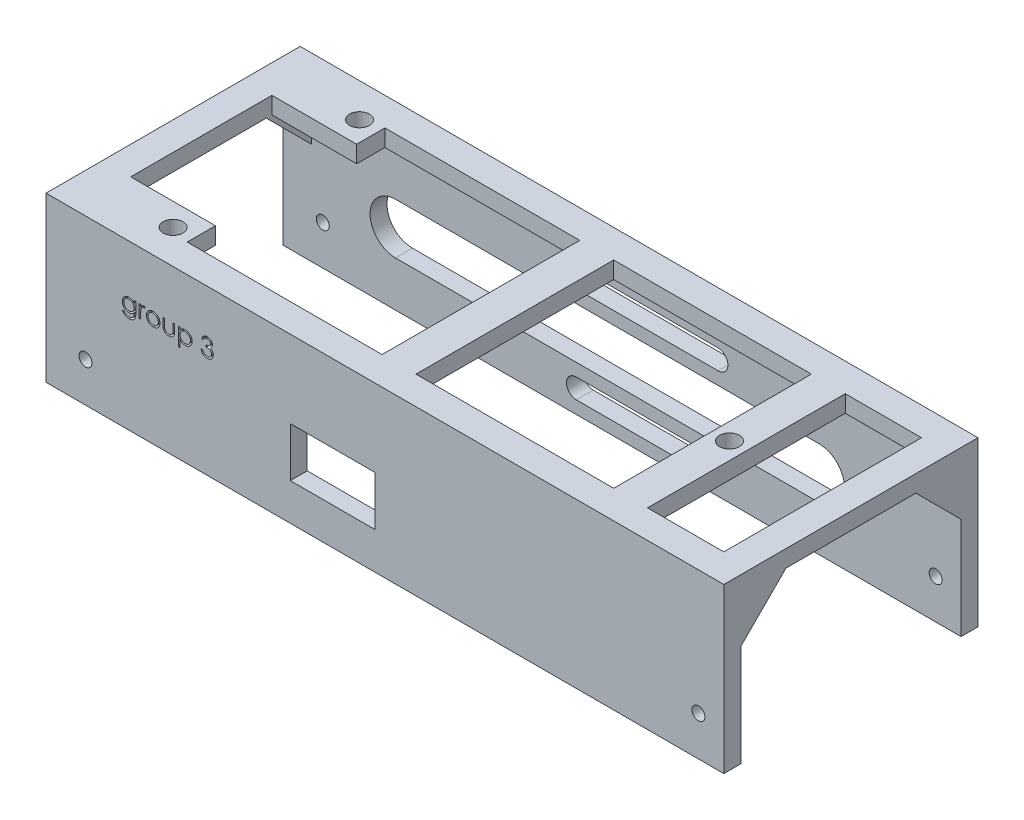
from build123d import *

# Parameters (mm, degrees)
SKETCH1_W           = 120
SKETCH1_H           = 29
BOSS_EXTRUDE5_DEPTH = 45
SHELL9_T            = -3
SKETCH3_R           = 1.15
CUT_EXTRUDE2_DEPTH  = 79
CUT_EXTRUDE8_DEPTH  = 23
SKETCH7_W           = 15
SKETCH7_H           = 8.75
CUT_EXTRUDE9_DEPTH  = 20
SKETCH13_W          = 110
SKETCH13_H          = 35
CUT_EXTRUDE14_DEPTH = 10
SKETCH17_W          = 15
SKETCH17_H          = 5
SKETCH17_W_2        = 6
SKETCH17_H_2        = 35
BOSS_EXTRUDE6_DEPTH = 3
SKETCH17_4_R        = 1.75
CUT_EXTRUDE16_DEPTH = 10
CUT_EXTRUDE15_DEPTH = 1.5
BOSS_EXTRUDE7_DEPTH = 5
BOSS_EXTRUDE8_DEPTH = 5


with BuildPart() as part:
    # Sketch1 → Boss-Extrude5 (new body)
    with BuildSketch(Plane.XY):
        with Locations((60, 14.5)):
            Rectangle(SKETCH1_W, SKETCH1_H)
    extrude(amount=BOSS_EXTRUDE5_DEPTH)

    # Shell9
    shell9_openings = [part.faces().sort_by_distance(p)[0] for p in [
        (120, 14.5, 22.5),
        (60, 0, 22.5),
        (0, 14.5, 22.5),
    ]]
    offset(amount=SHELL9_T, openings=shell9_openings, kind=Kind.INTERSECTION)

    # Sketch3 → Cut-Extrude2 (cut)
    with BuildSketch(Plane(origin=(0, 0, 0), x_dir=(-1, 0, 0), z_dir=(0, 0, -1))):
        with Locations((-7, 7)):
            Circle(SKETCH3_R)
        with Locations((-115.5, 7)):
            Circle(SKETCH3_R)
    extrude(amount=-CUT_EXTRUDE2_DEPTH, mode=Mode.SUBTRACT)

    # Sketch6 → Cut-Extrude8 (cut)
    with BuildSketch(Plane(origin=(0, 0, 0), x_dir=(-1, 0, 0), z_dir=(0, 0, -1))):
        with BuildLine():
            Line((-51.883496676, 22.75), (-76.973496676, 22.75))
            ThreePointArc((-76.973496676, 22.75), (-78.723496676, 21), (-76.973496676, 19.25))
            Line((-76.973496676, 19.25), (-51.883496676, 19.25))
            ThreePointArc((-51.883496676, 19.25), (-50.133496676, 21), (-51.883496676, 22.75))
        make_face()
        with BuildLine():
            Line((-19.873496676, 17), (-94.873496676, 17))
            ThreePointArc((-94.873496676, 17), (-99.373496676, 12.5), (-94.873496676, 8))
            Line((-94.873496676, 8), (-19.873496676, 8))
            ThreePointArc((-19.873496676, 8), (-15.373496676, 12.5), (-19.873496676, 17))
        make_face()
        with BuildLine():
            ThreePointArc((-76.973496676, 5.75), (-78.723496676, 4), (-76.973496676, 2.25))
            Line((-76.973496676, 2.25), (-51.883496676, 2.25))
            ThreePointArc((-51.883496676, 2.25), (-50.133496676, 4), (-51.883496676, 5.75))
            Line((-51.883496676, 5.75), (-76.973496676, 5.75))
        make_face()
    extrude(amount=-CUT_EXTRUDE8_DEPTH, mode=Mode.SUBTRACT)

    # Sketch7 → Cut-Extrude9 (cut)
    with BuildSketch(Plane.XY.offset(45)):
        with Locations((50.746172795, 10.921245049)):
            Rectangle(SKETCH7_W, SKETCH7_H)
    extrude(amount=-CUT_EXTRUDE9_DEPTH, mode=Mode.SUBTRACT)

    # Sketch13 → Cut-Extrude14 (cut)
    with BuildSketch(Plane(origin=(0, 29, 0), x_dir=(1, 0, 0), z_dir=(0, 1, 0))):
        with Locations((60, -22.5)):
            Rectangle(SKETCH13_W, SKETCH13_H)
    extrude(amount=-CUT_EXTRUDE14_DEPTH, mode=Mode.SUBTRACT)

    # Sketch17 → Boss-Extrude6 (add)
    with BuildSketch(Plane(origin=(0, 29, 0), x_dir=(1, 0, 0), z_dir=(0, 1, 0))):
        with Locations((12.5, -7.5)):
            Rectangle(SKETCH17_W, SKETCH17_H)
        with Locations((12.5, -37.5)):
            Rectangle(SKETCH17_W, SKETCH17_H)
        with Locations((57.5, -22.5)):
            Rectangle(SKETCH17_W_2, SKETCH17_H_2)
        with Locations((98.5, -22.5)):
            Rectangle(SKETCH17_W_2, SKETCH17_H_2)
    extrude(amount=-BOSS_EXTRUDE6_DEPTH)

    # Sketch17<4> → Cut-Extrude16 (cut)
    with BuildSketch(Plane(origin=(0, 29, 0), x_dir=(1, 0, 0), z_dir=(0, 1, 0))):
        with Locations((98.5, -22.5)):
            Circle(SKETCH17_4_R)
        with Locations((16.5, -6)):
            Circle(SKETCH17_4_R)
        with Locations((16.5, -39)):
            Circle(SKETCH17_4_R)
    extrude(amount=-CUT_EXTRUDE16_DEPTH, mode=Mode.SUBTRACT)

    # Sketch20 → Cut-Extrude15 (cut)
    # profile 1 of 6: a face of its own
    with BuildSketch(Plane.XY.offset(45)):
        with BuildLine():
            Line((15.616704574, 20.332761713), (15.901640472, 20.332761713))
            Line((15.901640472, 20.332761713), (15.901640472, 18.49149068))
            add(Edge.make_bspline(
                [(15.901640472, 18.49149068), (15.901389155, 18.452268005), (15.900904052, 18.376558794), (15.897410671, 18.267086354), (15.890044057, 18.165970691), (15.881690467, 18.072750642), (15.869673803, 17.9878583), (15.854999527, 17.91104035), (15.838457161, 17.842223075), (15.823924535, 17.799836969), (15.817050127, 17.779786954)],
                knots=[0, 0, 0, 0, 1.307562039, 2.523909702, 3.650326591, 4.686913197, 5.643429486, 6.506965704, 7.293745905, 8, 8, 8, 8], degree=3))
            add(Edge.make_bspline(
                [(15.817050127, 17.779786954), (15.806899889, 17.753724811), (15.786902899, 17.702379766), (15.749450931, 17.629595775), (15.707510176, 17.561064407), (15.659606909, 17.497167576), (15.605957751, 17.438226048), (15.547826683, 17.382959277), (15.484081581, 17.332536497), (15.414758892, 17.287827692), (15.341456639, 17.247562292), (15.264216961, 17.212685764), (15.183475406, 17.182308413), (15.098473497, 17.159554734), (15.010543928, 17.139838237), (14.918652687, 17.127006986), (14.823336649, 17.118273869), (14.758525483, 17.117466301), (14.725643877, 17.117056585)],
                knots=[0, 0, 0, 0, 0.981931301, 1.934503488, 2.87077864, 3.801706999, 4.735015492, 5.667491629, 6.616593066, 7.585388521, 8.561939025, 9.551802639, 10.560317337, 11.588439944, 12.640189604, 13.723962949, 14.845264515, 16, 16, 16, 16], degree=3))
            add(Edge.make_bspline(
                [(14.725643877, 17.117056585), (14.677669868, 17.11783354), (14.583963739, 17.119351142), (14.447343495, 17.137032186), (14.317590571, 17.162027939), (14.196419457, 17.19986072), (14.084595869, 17.246158561), (13.982883496, 17.299312554), (13.89219542, 17.360262855), (13.810440374, 17.429659829), (13.736651931, 17.512176883), (13.667230747, 17.609421549), (13.600409749, 17.722875084), (13.561249628, 17.806144188), (13.540743036, 17.849748893)],
                knots=[0, 0, 0, 0, 1.157897085, 2.2616841, 3.32207898, 4.345638746, 5.321241055, 6.241986252, 7.112515963, 7.955008012, 8.825025602, 9.77857164, 10.836726669, 12, 12, 12, 12], degree=3))
            Line((13.540743036, 17.849748893), (13.825678933, 17.849748893))
            add(Edge.make_bspline(
                [(13.825678933, 17.849748893), (13.848595366, 17.813367134), (13.89339417, 17.742245276), (13.977167435, 17.650158342), (14.068976031, 17.571460647), (14.171918315, 17.508041587), (14.286422618, 17.460226276), (14.412557826, 17.426140115), (14.55135034, 17.405732787), (14.647977577, 17.403273256), (14.698295119, 17.401992483)],
                knots=[0, 0, 0, 0, 0.997731894, 1.950442991, 2.880492273, 3.800895997, 4.748200782, 5.754801363, 6.83083817, 8, 8, 8, 8], degree=3))
            add(Edge.make_bspline(
                [(14.698295119, 17.401992483), (14.747976513, 17.403289832), (14.843757266, 17.405790991), (14.981489827, 17.426149222), (15.107215235, 17.460233694), (15.220209131, 17.507957016), (15.319138293, 17.566422742), (15.404420599, 17.631737095), (15.473494698, 17.705379862), (15.519952175, 17.773217644), (15.548830721, 17.833655247), (15.567220536, 17.885682245), (15.582164779, 17.944513069), (15.594665061, 18.009950487), (15.604980103, 18.08208799), (15.611514147, 18.161090521), (15.616236561, 18.246778529), (15.616544963, 18.306190162), (15.616704574, 18.336938396)],
                knots=[0, 0, 0, 0, 1.570740765, 3.028230971, 4.391408896, 5.680370741, 6.894727393, 8.017376726, 9.065722033, 10.075533815, 10.603371122, 11.180248986, 11.817768598, 12.521299649, 13.286540596, 14.121245857, 15.027658897, 16, 16, 16, 16], degree=3))
            Line((15.616704574, 18.336938396), (15.616704574, 18.457145728))
            add(Edge.make_bspline(
                [(15.616704574, 18.457145728), (15.587783846, 18.422727093), (15.530451097, 18.354495237), (15.431438879, 18.265085752), (15.323292106, 18.188081905), (15.206194892, 18.124927858), (15.083015558, 18.074416852), (14.955088249, 18.039090023), (14.823559742, 18.016266399), (14.734431006, 18.013810477), (14.689390872, 18.012569406)],
                knots=[0, 0, 0, 0, 1.012485704, 2.007162095, 2.997754123, 3.998611389, 4.999708251, 5.992315798, 6.98544096, 8, 8, 8, 8], degree=3))
            add(Edge.make_bspline(
                [(14.689390872, 18.012569406), (14.662869399, 18.013036608), (14.610140308, 18.013965485), (14.531804216, 18.022092376), (14.454624104, 18.033884092), (14.378779973, 18.051193683), (14.304162381, 18.073411178), (14.230894637, 18.101184934), (14.158383509, 18.132585791), (14.087947043, 18.169572548), (14.020286767, 18.210722641), (13.955913021, 18.255298635), (13.895162989, 18.303067225), (13.838614888, 18.354499449), (13.786342893, 18.409520868), (13.737643956, 18.467544948), (13.693323362, 18.52938192), (13.652471645, 18.593904232), (13.617040867, 18.661541641), (13.585940044, 18.730827485), (13.558898655, 18.801613615), (13.537340041, 18.874137022), (13.520874388, 18.948351984), (13.508618682, 19.02413692), (13.501667308, 19.1017252), (13.500583341, 19.153995995), (13.500037908, 19.180297771)],
                knots=[0, 0, 0, 0, 1.028754217, 2.045334182, 3.052854819, 4.056607503, 5.061168794, 6.071104265, 7.095078842, 8.125279047, 9.155117945, 10.165957491, 11.161587969, 12.151493252, 13.128948131, 14.104219989, 15.088194871, 16.07871515, 17.064853787, 18.047899887, 19.02414258, 20.002704429, 20.980574569, 21.971845993, 22.979467364, 24, 24, 24, 24], degree=3))
            add(Edge.make_bspline(
                [(13.500037908, 19.180297771), (13.500508866, 19.206607723), (13.501448958, 19.259125723), (13.509568775, 19.337030594), (13.521151346, 19.413892296), (13.53948268, 19.488918582), (13.561546682, 19.562963892), (13.588873066, 19.635481306), (13.621728655, 19.706492911), (13.658930356, 19.776051293), (13.700735212, 19.843223058), (13.746575391, 19.907019373), (13.796506234, 19.966970786), (13.8498389, 20.023682111), (13.907224591, 20.07660618), (13.96863362, 20.125614541), (14.033460661, 20.171528693), (14.101906631, 20.213358264), (14.172915405, 20.250353587), (14.24468294, 20.284110729), (14.31815991, 20.310902394), (14.391976428, 20.334509063), (14.467432493, 20.351232418), (14.543602915, 20.364134024), (14.620748464, 20.371994163), (14.672412876, 20.372975315), (14.698295119, 20.373466842)],
                knots=[0, 0, 0, 0, 1.008818848, 2.013730394, 3.001654427, 3.987803273, 4.973046549, 5.963777569, 6.957074694, 7.972068341, 8.987420212, 9.989399531, 10.982630087, 11.977756091, 12.973280677, 13.973972381, 14.989194003, 16.018387222, 17.047741039, 18.059210846, 19.057554164, 20.045176975, 21.029480261, 22.018708529, 23.007435371, 24, 24, 24, 24], degree=3))
            add(Edge.make_bspline(
                [(14.698295119, 20.373466842), (14.740977042, 20.372236145), (14.825260726, 20.369805898), (14.949295278, 20.350736716), (15.068985739, 20.320334718), (15.18500751, 20.276777682), (15.298305708, 20.217314433), (15.408506924, 20.138989044), (15.515929996, 20.04109895), (15.582222028, 19.966030281), (15.616704574, 19.926982467)],
                knots=[0, 0, 0, 0, 0.96728863, 1.910097829, 2.838038873, 3.762875196, 4.71315279, 5.730631239, 6.819562287, 8, 8, 8, 8], degree=3))
            Line((15.616704574, 19.926982467), (15.616704574, 20.332761713))
        make_face()
        with BuildLine():
            add(Edge.make_bspline(
                [(14.721191754, 20.088530944), (14.679526044, 20.087114835), (14.597036773, 20.084311238), (14.476125205, 20.060376534), (14.359396844, 20.022869897), (14.249083349, 19.969219095), (14.145753328, 19.903819322), (14.054064026, 19.824589204), (13.973868138, 19.734105154), (13.90602933, 19.633185287), (13.852025876, 19.524307938), (13.813795774, 19.409544629), (13.78907611, 19.290749742), (13.78634774, 19.209676024), (13.784973805, 19.168849454)],
                knots=[0, 0, 0, 0, 1.026226791, 2.031711442, 3.026614839, 4.04107745, 5.047145931, 6.032893242, 7.017642609, 8.019221815, 9.021877557, 10.003543541, 10.994637589, 12, 12, 12, 12], degree=3))
            add(Edge.make_bspline(
                [(13.784973805, 19.168849454), (13.78563217, 19.138067128), (13.786926982, 19.077527295), (13.799376227, 18.988683633), (13.819497532, 18.904065063), (13.848015569, 18.823666466), (13.883351228, 18.747026688), (13.927794307, 18.674673668), (13.980091974, 18.60654297), (14.039834895, 18.543138509), (14.105672041, 18.485388916), (14.177081601, 18.434645122), (14.25396672, 18.393142682), (14.334436469, 18.357273494), (14.42044337, 18.331076054), (14.510748612, 18.311083733), (14.605991079, 18.299645788), (14.670916871, 18.298228108), (14.704019278, 18.297505303)],
                knots=[0, 0, 0, 0, 1.039728707, 2.044842319, 3.024901384, 3.974314358, 4.923051295, 5.871625912, 6.837440708, 7.820715446, 8.810779094, 9.792721783, 10.773906224, 11.758876063, 12.764959493, 13.806266761, 14.881525401, 16, 16, 16, 16], degree=3))
            add(Edge.make_bspline(
                [(14.704019278, 18.297505303), (14.737550687, 18.298201634), (14.803121003, 18.299563302), (14.898888923, 18.311268619), (14.989632909, 18.330157126), (15.075269755, 18.356975013), (15.1561228, 18.39119403), (15.231283772, 18.434497961), (15.302364264, 18.483814268), (15.367094722, 18.541338023), (15.425627358, 18.604733697), (15.476636696, 18.673717281), (15.520101946, 18.747250752), (15.556095261, 18.825325821), (15.583573711, 18.908549241), (15.60200586, 18.996712964), (15.614893407, 19.089394606), (15.616091675, 19.152902422), (15.616704574, 19.185385912)],
                knots=[0, 0, 0, 0, 1.121943988, 2.193949579, 3.223793937, 4.220241907, 5.192961521, 6.155822191, 7.11847367, 8.083710714, 9.04790392, 10.001595906, 10.949595423, 11.902125208, 12.873731292, 13.87582262, 14.913508608, 16, 16, 16, 16], degree=3))
            add(Edge.make_bspline(
                [(15.616704574, 19.185385912), (15.615489395, 19.227674965), (15.613115361, 19.310292915), (15.59071151, 19.430676912), (15.554588891, 19.543859923), (15.503927909, 19.649483987), (15.440444229, 19.746429935), (15.363980388, 19.83290228), (15.27585506, 19.909012343), (15.176321441, 19.97241999), (15.069235544, 20.023642205), (14.957184173, 20.062070384), (14.840333683, 20.083836656), (14.761134297, 20.086957176), (14.721191754, 20.088530944)],
                knots=[0, 0, 0, 0, 1.070913519, 2.092188694, 3.091357305, 4.074328408, 5.051968682, 6.018948707, 6.99050112, 7.9935919, 9.000589572, 9.992915277, 10.987769056, 12, 12, 12, 12], degree=3))
        make_face(mode=Mode.SUBTRACT)
    # profile 2 of 6: a face of its own
    with BuildSketch(Plane.XY.offset(45)):
        with BuildLine():
            Line((16.471512267, 20.332761713), (16.756448164, 20.332761713))
            Line((16.756448164, 20.332761713), (16.756448164, 19.991220247))
            add(Edge.make_bspline(
                [(16.756448164, 19.991220247), (16.777483681, 20.023020891), (16.817713944, 20.083839376), (16.884582101, 20.1642751), (16.953074409, 20.230873035), (17.023518757, 20.283944084), (17.096433176, 20.323688842), (17.170217411, 20.352801809), (17.246032302, 20.370016945), (17.29697919, 20.372315336), (17.322503853, 20.373466842)],
                knots=[0, 0, 0, 0, 1.2804753, 2.448899062, 3.506932113, 4.484331642, 5.4025378, 6.288909075, 7.142734305, 8, 8, 8, 8], degree=3))
            add(Edge.make_bspline(
                [(17.322503853, 20.373466842), (17.342303449, 20.372386864), (17.383042405, 20.37016474), (17.444712326, 20.354552063), (17.508251743, 20.329625571), (17.549202337, 20.306184798), (17.570550728, 20.293964638)],
                knots=[0, 0, 0, 0, 0.901110191, 1.854092781, 2.881294221, 4, 4, 4, 4], degree=3))
            Line((17.570550728, 20.293964638), (17.414090392, 20.047189798))
            add(Edge.make_bspline(
                [(17.414090392, 20.047189798), (17.400384351, 20.053304183), (17.374367662, 20.064910455), (17.336308877, 20.078646421), (17.301219379, 20.08673443), (17.278864151, 20.087959724), (17.268442355, 20.088530944)],
                knots=[0, 0, 0, 0, 1.180555205, 2.24091978, 3.179933427, 4, 4, 4, 4], degree=3))
            add(Edge.make_bspline(
                [(17.268442355, 20.088530944), (17.245577154, 20.08700691), (17.198938771, 20.083898323), (17.130463547, 20.059460976), (17.064017868, 20.019977365), (17.01124786, 19.976188571), (16.970388102, 19.933963069), (16.941232326, 19.897089161), (16.914487262, 19.855742831), (16.888932848, 19.810630903), (16.865649853, 19.760983115), (16.843919546, 19.707295485), (16.824271863, 19.649505833), (16.813068427, 19.609244546), (16.807329574, 19.588621088)],
                knots=[0, 0, 0, 0, 1.125678352, 2.296057538, 3.5422874, 4.923748041, 5.663163013, 6.437101912, 7.23742474, 8.08941207, 8.991984279, 9.93940061, 10.944477711, 12, 12, 12, 12], degree=3))
            add(Edge.make_bspline(
                [(16.807329574, 19.588621088), (16.803036618, 19.570226795), (16.793528044, 19.529484834), (16.784282864, 19.461132958), (16.775148372, 19.380375782), (16.768710726, 19.286988515), (16.762743502, 19.18120437), (16.759377927, 19.06286219), (16.756562935, 18.931840507), (16.756487582, 18.840242344), (16.756448164, 18.792327018)],
                knots=[0, 0, 0, 0, 0.566838948, 1.255505196, 2.06880316, 3.007127437, 4.065329342, 5.249902469, 6.561414163, 8, 8, 8, 8], degree=3))
            Line((16.756448164, 18.792327018), (16.756448164, 18.012569406))
            Line((16.756448164, 18.012569406), (16.471512267, 18.012569406))
            Line((16.471512267, 18.012569406), (16.471512267, 20.332761713))
        make_face()
    # profile 3 of 6: a face of its own
    with BuildSketch(Plane.XY.offset(45)):
        with BuildLine():
            add(Edge.make_bspline(
                [(18.976149687, 20.373466842), (19.019684627, 20.37253984), (19.105046006, 20.370722218), (19.230057445, 20.351295784), (19.349387675, 20.321589247), (19.463493721, 20.280521473), (19.570914218, 20.225474275), (19.673213846, 20.159788703), (19.770112133, 20.081971636), (19.828190167, 20.021775389), (19.857670119, 19.991220247)],
                knots=[0, 0, 0, 0, 1.054011418, 2.066658804, 3.057071809, 4.030435133, 4.997543892, 5.974964718, 6.972108034, 8, 8, 8, 8], degree=3))
            add(Edge.make_bspline(
                [(19.857670119, 19.991220247), (19.883053749, 19.96199756), (19.933329765, 19.904117725), (19.997796525, 19.810268705), (20.053333226, 19.713077328), (20.09784034, 19.611252967), (20.132933183, 19.505684516), (20.157848493, 19.39600912), (20.172668427, 19.282468991), (20.174666833, 19.205358366), (20.175678933, 19.166305383)],
                knots=[0, 0, 0, 0, 1.025258237, 2.030674902, 3.01204498, 3.988269485, 4.97094183, 5.956517959, 6.965070386, 8, 8, 8, 8], degree=3))
            add(Edge.make_bspline(
                [(20.175678933, 19.166305383), (20.17478872, 19.127026045), (20.173029618, 19.049408242), (20.156389337, 18.935090674), (20.130507566, 18.824242513), (20.093467256, 18.717327841), (20.045970971, 18.614019848), (19.98801299, 18.514769757), (19.919186595, 18.41938175), (19.841168683, 18.328665797), (19.754943053, 18.245057873), (19.661401975, 18.172188657), (19.562383673, 18.109757703), (19.456571489, 18.059468955), (19.344931697, 18.019818012), (19.227223499, 17.991968712), (19.103629757, 17.975130613), (19.019240778, 17.972968371), (18.976149687, 17.971864278)],
                knots=[0, 0, 0, 0, 0.998656419, 1.973391657, 2.932242238, 3.890759089, 4.846373663, 5.82037756, 6.809684879, 7.83454468, 8.860553229, 9.859544525, 10.845671541, 11.83227036, 12.833544569, 13.85385346, 14.904124723, 16, 16, 16, 16], degree=3))
            add(Edge.make_bspline(
                [(18.976149687, 17.971864278), (18.932847477, 17.972972077), (18.848037911, 17.975141758), (18.724007913, 17.991903293), (18.606088759, 18.019805177), (18.494302816, 18.05959926), (18.388035705, 18.10975931), (18.288443668, 18.171999915), (18.194826602, 18.245079484), (18.10858273, 18.328659941), (18.03056971, 18.419383259), (17.961742052, 18.514769365), (17.903784399, 18.61401995), (17.856288029, 18.717327814), (17.819247741, 18.824242521), (17.793365964, 18.935090672), (17.776725685, 19.049408242), (17.774966583, 19.127026045), (17.774076369, 19.166305383)],
                knots=[0, 0, 0, 0, 1.099876186, 2.154163076, 3.173186993, 4.173200201, 5.163417411, 6.152872554, 7.150605724, 8.17532212, 9.198891216, 10.186952605, 11.159729845, 12.11414092, 13.071450619, 14.029093627, 15.002601286, 16, 16, 16, 16], degree=3))
            add(Edge.make_bspline(
                [(17.774076369, 19.166305383), (17.775095372, 19.205146107), (17.777112823, 19.282044065), (17.791917856, 19.395370756), (17.816735975, 19.50486053), (17.851870885, 19.610021498), (17.896788237, 19.711399643), (17.951544548, 19.808831168), (18.016668907, 19.902255816), (18.066744963, 19.960060846), (18.092085183, 19.989312194)],
                knots=[0, 0, 0, 0, 1.031353054, 2.041901799, 3.029428768, 4.008703097, 4.981709435, 5.96992636, 6.972712378, 8, 8, 8, 8], degree=3))
            add(Edge.make_bspline(
                [(18.092085183, 19.989312194), (18.121520691, 20.020132318), (18.179410796, 20.080745514), (18.276791428, 20.158335732), (18.378839394, 20.22538817), (18.487447005, 20.279341594), (18.601459312, 20.321830821), (18.721401054, 20.351372396), (18.8468367, 20.370652225), (18.932615785, 20.372519286), (18.976149687, 20.373466842)],
                knots=[0, 0, 0, 0, 1.027980169, 2.021703884, 2.998553061, 3.971491411, 4.943284454, 5.930300938, 6.949603206, 8, 8, 8, 8], degree=3))
        make_face()
        with BuildLine():
            add(Edge.make_bspline(
                [(18.974877651, 20.088530944), (18.94409139, 20.087655922), (18.883313609, 20.085928465), (18.793851557, 20.072789495), (18.707727274, 20.05197283), (18.624777366, 20.022396294), (18.545281559, 19.984206578), (18.469163744, 19.937299709), (18.396200031, 19.882296955), (18.327817731, 19.819284389), (18.26505949, 19.750451301), (18.210197326, 19.67711029), (18.163547408, 19.600450961), (18.124685264, 19.520393598), (18.095740886, 19.436126908), (18.074719644, 19.348605193), (18.061593069, 19.257650137), (18.059881854, 19.195818356), (18.059012267, 19.16439733)],
                knots=[0, 0, 0, 0, 1.021534396, 2.016698045, 2.994645724, 3.958388632, 4.93408049, 5.916473867, 6.921342795, 7.962252576, 8.998418191, 10.008913653, 10.997312074, 11.973003931, 12.956656626, 13.948281152, 14.957379055, 16, 16, 16, 16], degree=3))
            add(Edge.make_bspline(
                [(18.059012267, 19.16439733), (18.060469885, 19.123800849), (18.063362986, 19.043224424), (18.08688995, 18.924560048), (18.126247504, 18.810639368), (18.179394536, 18.702130218), (18.245984463, 18.601734651), (18.324440588, 18.512225519), (18.413920888, 18.434949819), (18.513358713, 18.370832194), (18.620722987, 18.319887273), (18.734348364, 18.283783917), (18.852858136, 18.260314596), (18.933848514, 18.257981901), (18.974877651, 18.256800175)],
                knots=[0, 0, 0, 0, 1.016792936, 2.018143844, 3.017858371, 4.030088057, 5.03801393, 6.028138512, 7.003788237, 7.991172063, 8.984598303, 9.972568034, 10.972917682, 12, 12, 12, 12], degree=3))
            add(Edge.make_bspline(
                [(18.974877651, 18.256800175), (19.015904429, 18.257988786), (19.096890148, 18.260335072), (19.215235258, 18.283665716), (19.328550076, 18.320045465), (19.435802834, 18.370774898), (19.535195396, 18.435193303), (19.625319242, 18.51178916), (19.703105482, 18.601971725), (19.769629538, 18.702263197), (19.82364694, 18.810471145), (19.862820273, 18.924581074), (19.886403798, 19.043219069), (19.889289264, 19.123799055), (19.890743036, 19.16439733)],
                knots=[0, 0, 0, 0, 1.02726834, 2.027799167, 3.010890988, 4.004497153, 4.992059811, 5.971914811, 6.958719428, 7.966827853, 8.981595046, 9.981490638, 10.983022906, 12, 12, 12, 12], degree=3))
            add(Edge.make_bspline(
                [(19.890743036, 19.16439733), (19.889873748, 19.195818544), (19.888163122, 19.257650694), (19.875032262, 19.348603063), (19.854026879, 19.436134725), (19.825024055, 19.520364757), (19.786330771, 19.600658243), (19.738781252, 19.67688521), (19.684143107, 19.750705362), (19.620627576, 19.819061879), (19.552316655, 19.882321519), (19.47932337, 19.937321037), (19.403318425, 19.984000427), (19.324053568, 20.022722945), (19.241093025, 20.051703747), (19.155089415, 20.072909691), (19.066009066, 20.085872941), (19.005449077, 20.087639276), (18.974877651, 20.088530944)],
                knots=[0, 0, 0, 0, 1.042956736, 2.052379634, 3.044323526, 4.02829302, 5.004299113, 5.996692471, 7.007513377, 8.048758398, 9.090003419, 10.095195979, 11.07790575, 12.047570684, 13.018257071, 13.989683339, 14.985167495, 16, 16, 16, 16], degree=3))
        make_face(mode=Mode.SUBTRACT)
    # profile 4 of 6: a face of its own
    with BuildSketch(Plane.XY.offset(45)):
        with BuildLine():
            Line((20.7048456, 20.332761713), (20.989781497, 20.332761713))
            Line((20.989781497, 20.332761713), (20.989781497, 19.256619887))
            add(Edge.make_bspline(
                [(20.989781497, 19.256619887), (20.989910225, 19.225030678), (20.990156476, 19.164602003), (20.991826473, 19.077647655), (20.995754486, 18.998348208), (21.000665598, 18.926657854), (21.00698125, 18.86258872), (21.014495442, 18.806364589), (21.022894153, 18.757347865), (21.031115329, 18.727826393), (21.034938749, 18.71409685)],
                knots=[0, 0, 0, 0, 1.388932606, 2.656963016, 3.823490214, 4.879454478, 5.816252168, 6.653371382, 7.373723809, 8, 8, 8, 8], degree=3))
            add(Edge.make_bspline(
                [(21.034938749, 18.71409685), (21.041072355, 18.696840388), (21.05321205, 18.662686223), (21.075231567, 18.613347625), (21.102471558, 18.567650048), (21.132280116, 18.523831353), (21.166660293, 18.483189551), (21.205177099, 18.445793272), (21.246541214, 18.410229561), (21.3080047, 18.368151928), (21.392059891, 18.323053022), (21.502416319, 18.284140387), (21.622072295, 18.260885035), (21.704771719, 18.258186961), (21.747278493, 18.256800175)],
                knots=[0, 0, 0, 0, 0.725840625, 1.436591201, 2.137033971, 2.831655856, 3.53531722, 4.242432219, 4.957935707, 5.694543706, 7.190802206, 8.724350549, 10.316345118, 12, 12, 12, 12], degree=3))
            add(Edge.make_bspline(
                [(21.747278493, 18.256800175), (21.789781318, 18.258216451), (21.872016419, 18.260956682), (21.990357713, 18.283438892), (22.098535782, 18.320999767), (22.195464859, 18.373439347), (22.2807053, 18.437612504), (22.351738594, 18.512913352), (22.410346603, 18.596959582), (22.435936578, 18.659665178), (22.448805937, 18.691200215)],
                knots=[0, 0, 0, 0, 1.157059328, 2.238695713, 3.266970494, 4.264342957, 5.228770407, 6.160125903, 7.074715775, 8, 8, 8, 8], degree=3))
            add(Edge.make_bspline(
                [(22.448805937, 18.691200215), (22.452610702, 18.703869643), (22.46102211, 18.731878654), (22.470059386, 18.779394569), (22.478200505, 18.836058889), (22.485152101, 18.902242407), (22.490109784, 18.977772166), (22.492782251, 19.062624564), (22.495801472, 19.156533227), (22.495847297, 19.222271837), (22.495871241, 19.256619887)],
                knots=[0, 0, 0, 0, 0.557542046, 1.232589297, 2.036731608, 2.971723315, 4.038036528, 5.22795436, 6.551621927, 8, 8, 8, 8], degree=3))
            Line((22.495871241, 19.256619887), (22.495871241, 20.332761713))
            Line((22.495871241, 20.332761713), (22.780807138, 20.332761713))
            Line((22.780807138, 20.332761713), (22.780807138, 19.203194406))
            add(Edge.make_bspline(
                [(22.780807138, 19.203194406), (22.780406458, 19.164815757), (22.779629084, 19.09035593), (22.774633136, 18.9821482), (22.766060988, 18.881308163), (22.753050123, 18.787782443), (22.737750547, 18.701642441), (22.7180145, 18.622777758), (22.694448527, 18.551431377), (22.667864238, 18.486351337), (22.636457258, 18.427344511), (22.60304989, 18.371341306), (22.564473847, 18.319731286), (22.523860848, 18.269945348), (22.478683632, 18.224459819), (22.42978876, 18.18223098), (22.377864429, 18.142613302), (22.321758371, 18.107151927), (22.262289657, 18.075205398), (22.199384872, 18.046887956), (22.132273538, 18.02447919), (22.061821525, 18.005147372), (21.98768366, 17.98998496), (21.909931418, 17.97929286), (21.828590988, 17.972738453), (21.773155978, 17.972160562), (21.744734422, 17.971864278)],
                knots=[0, 0, 0, 0, 1.493040784, 2.896703357, 4.213163133, 5.428574705, 6.569057535, 7.615249723, 8.588095153, 9.490268104, 10.346124644, 11.18633936, 12.024365274, 12.850166724, 13.684164916, 14.514361689, 15.362232829, 16.222528818, 17.093394965, 17.986930858, 18.902426812, 19.842810585, 20.827885679, 21.843828298, 22.894529745, 24, 24, 24, 24], degree=3))
            add(Edge.make_bspline(
                [(21.744734422, 17.971864278), (21.716525441, 17.97217244), (21.661092168, 17.972778009), (21.57974754, 17.979256649), (21.501779875, 17.989968347), (21.427466371, 18.005258437), (21.356732454, 18.024343879), (21.289291607, 18.047025657), (21.225933518, 18.075220094), (21.165896986, 18.106949736), (21.109651962, 18.142841093), (21.056939181, 18.1821821), (21.007829322, 18.224914029), (20.962311553, 18.270858417), (20.921024781, 18.320585209), (20.883454515, 18.373694396), (20.849022361, 18.429659748), (20.817859472, 18.489588474), (20.791088094, 18.555421654), (20.767452264, 18.628262592), (20.748120471, 18.708909875), (20.732388374, 18.797294553), (20.719732425, 18.892993627), (20.71094571, 18.996560689), (20.706032778, 19.107743467), (20.705249858, 19.18453301), (20.7048456, 19.224182988)],
                knots=[0, 0, 0, 0, 1.083640291, 2.129454052, 3.13281866, 4.105697902, 5.042300162, 5.946461698, 6.836384745, 7.703652036, 8.553297018, 9.397182691, 10.228592656, 11.052265423, 11.879314572, 12.708807002, 13.549817954, 14.402308542, 15.300838682, 16.27712199, 17.341985831, 18.484375296, 19.725102775, 21.0496083, 22.476576903, 24, 24, 24, 24], degree=3))
            Line((20.7048456, 19.224182988), (20.7048456, 20.332761713))
        make_face()
    # profile 5 of 6: a face of its own
    with BuildSketch(Plane.XY.offset(45)):
        with BuildLine():
            Line((23.43208919, 20.332761713), (23.717025087, 20.332761713))
            Line((23.717025087, 20.332761713), (23.717025087, 19.903449814))
            add(Edge.make_bspline(
                [(23.717025087, 19.903449814), (23.747285091, 19.942400473), (23.806089351, 20.018093283), (23.907439801, 20.116055757), (24.014416263, 20.198674068), (24.129771645, 20.263428223), (24.251713135, 20.312251388), (24.379740309, 20.348337032), (24.51493976, 20.369601798), (24.607374399, 20.372161448), (24.654515071, 20.373466842)],
                knots=[0, 0, 0, 0, 1.0828784, 2.104357462, 3.088488658, 4.04616522, 5.001424249, 5.969181776, 6.964304535, 8, 8, 8, 8], degree=3))
            add(Edge.make_bspline(
                [(24.654515071, 20.373466842), (24.69569174, 20.372275601), (24.777079588, 20.369921051), (24.896879803, 20.35397978), (25.012246044, 20.32665873), (25.122525636, 20.2872879), (25.228899988, 20.238614724), (25.329794321, 20.177185698), (25.42678019, 20.106060082), (25.517418447, 20.024206631), (25.601167116, 19.935643847), (25.673599009, 19.840373614), (25.736075665, 19.741528982), (25.786576577, 19.637577584), (25.826135578, 19.529337997), (25.854270321, 19.416372911), (25.87101404, 19.299101165), (25.873260536, 19.21936084), (25.874396882, 19.179025736)],
                knots=[0, 0, 0, 0, 1.041296284, 2.058176809, 3.050446431, 4.034000596, 5.01514041, 6.003636468, 7.015969324, 8.052561599, 9.08815499, 10.094063707, 11.074456064, 12.040834395, 13.011057502, 13.983766392, 14.980127149, 16, 16, 16, 16], degree=3))
            add(Edge.make_bspline(
                [(25.874396882, 19.179025736), (25.873285192, 19.137839356), (25.871092778, 19.056613871), (25.854088379, 18.93733629), (25.826913215, 18.822594172), (25.787853292, 18.712578369), (25.737378513, 18.607364628), (25.675960805, 18.507028826), (25.603492367, 18.41160311), (25.520669201, 18.322382979), (25.430814037, 18.240196459), (25.334768029, 18.16831621), (25.234021718, 18.107953677), (25.129090538, 18.057531992), (25.019076209, 18.019529797), (24.904492021, 17.992117935), (24.785400359, 17.975213785), (24.704391457, 17.972989342), (24.663419318, 17.971864278)],
                knots=[0, 0, 0, 0, 1.038740735, 2.04854663, 3.033179607, 4.009277356, 4.987731542, 5.972001279, 6.972200261, 8.005528982, 9.039189865, 10.040446548, 11.026516639, 11.997840187, 12.972163198, 13.956796175, 14.96660207, 16, 16, 16, 16], degree=3))
            add(Edge.make_bspline(
                [(24.663419318, 17.971864278), (24.617311449, 17.973038853), (24.52623489, 17.975358984), (24.393068432, 17.998871592), (24.264910145, 18.034011526), (24.143179897, 18.085445614), (24.026913381, 18.150991689), (23.916768272, 18.230920233), (23.812159503, 18.325064085), (23.749195845, 18.39648509), (23.717025087, 18.432977058)],
                knots=[0, 0, 0, 0, 1.014726462, 2.004382257, 2.969841629, 3.936926163, 4.907207904, 5.903978561, 6.929055279, 8, 8, 8, 8], degree=3))
            Line((23.717025087, 18.432977058), (23.717025087, 17.157761713))
            Line((23.717025087, 17.157761713), (23.43208919, 17.157761713))
            Line((23.43208919, 17.157761713), (23.43208919, 20.332761713))
        make_face()
        with BuildLine():
            add(Edge.make_bspline(
                [(24.651971001, 20.088530944), (24.619695255, 20.087950139), (24.55615263, 20.086806682), (24.46301426, 20.073223171), (24.373301979, 20.053503935), (24.287919923, 20.023648139), (24.206049721, 19.987000645), (24.128321943, 19.941206249), (24.05479115, 19.887093358), (23.985642343, 19.825698524), (23.923173499, 19.758048629), (23.867871414, 19.685851116), (23.821419073, 19.609197418), (23.782863669, 19.528801553), (23.753523691, 19.44403333), (23.732699574, 19.355375526), (23.719609182, 19.262731101), (23.717895646, 19.199633867), (23.717025087, 19.167577419)],
                knots=[0, 0, 0, 0, 1.05670511, 2.080379991, 3.077984906, 4.06214886, 5.038337365, 6.01289324, 7.01187578, 8.025460281, 9.038092164, 10.024533457, 11.000252242, 11.969694649, 12.940728589, 13.933144304, 14.949937299, 16, 16, 16, 16], degree=3))
            add(Edge.make_bspline(
                [(23.717025087, 19.167577419), (23.718468221, 19.125496774), (23.721295442, 19.043057226), (23.744280055, 18.922603059), (23.78168633, 18.808619057), (23.834780234, 18.702065116), (23.901861248, 18.604109258), (23.982686004, 18.516397065), (24.076523176, 18.439479886), (24.181812699, 18.374690606), (24.294681347, 18.322087146), (24.41241571, 18.284427827), (24.533396709, 18.261230162), (24.615192256, 18.258284834), (24.656423124, 18.256800175)],
                knots=[0, 0, 0, 0, 1.03728447, 2.032128127, 3.01272805, 3.987917167, 4.958271349, 5.931593992, 6.91984656, 7.941419022, 8.973179163, 9.983609215, 10.983593296, 12, 12, 12, 12], degree=3))
            add(Edge.make_bspline(
                [(24.656423124, 18.256800175), (24.696823428, 18.258212031), (24.777010768, 18.261014312), (24.895082778, 18.285269668), (25.009827857, 18.32232194), (25.118848442, 18.376350966), (25.221195463, 18.442563376), (25.313616587, 18.521992835), (25.394358573, 18.614058712), (25.463178381, 18.716573568), (25.518633371, 18.826496952), (25.56029866, 18.940235783), (25.584345723, 19.057389131), (25.587753667, 19.136308485), (25.589460985, 19.175845648)],
                knots=[0, 0, 0, 0, 1.00104056, 1.986885549, 2.97790532, 3.984399681, 4.995088187, 5.994304198, 6.996462723, 8.023150851, 9.048424203, 10.043036403, 11.019596776, 12, 12, 12, 12], degree=3))
            add(Edge.make_bspline(
                [(25.589460985, 19.175845648), (25.588141333, 19.215628388), (25.585512312, 19.294883921), (25.55961607, 19.411690268), (25.520699662, 19.525888647), (25.463949665, 19.63431086), (25.396638513, 19.736613063), (25.315225166, 19.826922653), (25.223951902, 19.905998906), (25.121726732, 19.971327171), (25.012016489, 20.023293299), (24.896523672, 20.061287742), (24.775834119, 20.08412393), (24.693621889, 20.087049017), (24.651971001, 20.088530944)],
                knots=[0, 0, 0, 0, 0.983928682, 1.960191568, 2.949917689, 3.96440592, 4.982380491, 5.975291189, 6.965713506, 7.964880129, 8.970154049, 9.96478489, 10.968906225, 12, 12, 12, 12], degree=3))
        make_face(mode=Mode.SUBTRACT)
    # profile 6 of 6: a face of its own
    with BuildSketch(Plane.XY.offset(45)):
        with BuildLine():
            Line((27.868948164, 20.454877098), (27.584012267, 20.454877098))
            add(Edge.make_bspline(
                [(27.584012267, 20.454877098), (27.591731645, 20.486837994), (27.606822398, 20.549318932), (27.638298054, 20.638588376), (27.672587378, 20.723064713), (27.71376178, 20.801166151), (27.758673293, 20.874462299), (27.810128904, 20.941290719), (27.865754653, 21.003351052), (27.927281571, 21.058426632), (27.991805428, 21.108299286), (28.060235405, 21.150821659), (28.131194744, 21.187401427), (28.205175086, 21.217536923), (28.282396685, 21.240238648), (28.362161414, 21.256709464), (28.444678304, 21.267405689), (28.50069219, 21.268449596), (28.529134462, 21.268979662)],
                knots=[0, 0, 0, 0, 1.162005537, 2.271625781, 3.343758855, 4.383309926, 5.390229558, 6.379919256, 7.361854164, 8.333198761, 9.295911338, 10.242430842, 11.177959212, 12.116337295, 13.062827104, 14.020064771, 14.994644689, 16, 16, 16, 16], degree=3))
            add(Edge.make_bspline(
                [(28.529134462, 21.268979662), (28.570575235, 21.267728503), (28.652552838, 21.265253477), (28.772987888, 21.242652524), (28.889126502, 21.206888297), (28.999697463, 21.157472844), (29.102402755, 21.096524353), (29.193784868, 21.023984913), (29.27260516, 20.941254118), (29.338730774, 20.849875292), (29.390505951, 20.752216366), (29.428684304, 20.651704794), (29.451926829, 20.548579006), (29.454939049, 20.478949189), (29.456448164, 20.444064798)],
                knots=[0, 0, 0, 0, 1.083050992, 2.142477498, 3.193116406, 4.255571735, 5.30263384, 6.308962982, 7.297363603, 8.282367274, 9.249857812, 10.179914175, 11.08814088, 12, 12, 12, 12], degree=3))
            add(Edge.make_bspline(
                [(29.456448164, 20.444064798), (29.455392621, 20.410494349), (29.453327086, 20.344802189), (29.435788653, 20.248897688), (29.406273615, 20.158508522), (29.365388902, 20.073254182), (29.312464781, 19.99367522), (29.248354549, 19.919592591), (29.172605706, 19.850677711), (29.115202669, 19.811199332), (29.085649887, 19.790874694)],
                knots=[0, 0, 0, 0, 1.024540389, 2.004866551, 2.965041327, 3.920577974, 4.882998113, 5.874504559, 6.905732034, 8, 8, 8, 8], degree=3))
            add(Edge.make_bspline(
                [(29.085649887, 19.790874694), (29.119424407, 19.774565924), (29.1863415, 19.742253534), (29.277555195, 19.678884383), (29.360357267, 19.605717553), (29.406534213, 19.548619575), (29.429735424, 19.519931185)],
                knots=[0, 0, 0, 0, 1.015518401, 2.012035669, 3.001164323, 4, 4, 4, 4], degree=3))
            add(Edge.make_bspline(
                [(29.429735424, 19.519931185), (29.445012927, 19.49901451), (29.475317754, 19.457523686), (29.512724274, 19.390815642), (29.546659685, 19.32336822), (29.573103098, 19.253373616), (29.59358082, 19.181643096), (29.608218507, 19.108053494), (29.617311835, 19.032544717), (29.618614085, 18.981461252), (29.619268677, 18.955783548)],
                knots=[0, 0, 0, 0, 1.025084078, 2.033381695, 3.024893161, 4.013698104, 4.991890475, 5.976764909, 6.982997093, 8, 8, 8, 8], degree=3))
            add(Edge.make_bspline(
                [(29.619268677, 18.955783548), (29.617640797, 18.91132473), (29.614392697, 18.822616317), (29.58536043, 18.691557105), (29.540354133, 18.563445399), (29.476439627, 18.440913224), (29.39854553, 18.326268164), (29.305874243, 18.223691798), (29.199478715, 18.135518778), (29.080819305, 18.0618495), (28.952261624, 18.00295967), (28.814760909, 17.962086133), (28.67029836, 17.935465119), (28.57123174, 17.932610459), (28.520866233, 17.931159149)],
                knots=[0, 0, 0, 0, 0.955779014, 1.907060117, 2.875433937, 3.871313158, 4.872415639, 5.851225146, 6.836215519, 7.83643374, 8.849228613, 9.86973379, 10.916971861, 12, 12, 12, 12], degree=3))
            add(Edge.make_bspline(
                [(28.520866233, 17.931159149), (28.486921582, 17.931946743), (28.420129828, 17.933496464), (28.321937512, 17.944090624), (28.22820997, 17.963439986), (28.138820478, 17.989477984), (28.053689623, 18.022490493), (27.973077185, 18.063601026), (27.89648721, 18.111962174), (27.824642448, 18.168144786), (27.757551461, 18.230992859), (27.696997204, 18.301622104), (27.641970106, 18.378726891), (27.59394357, 18.463202807), (27.550730048, 18.553958147), (27.515187323, 18.652154999), (27.483903986, 18.756915505), (27.469359344, 18.829920312), (27.461896882, 18.867377098)],
                knots=[0, 0, 0, 0, 1.048658725, 2.063410685, 3.046034179, 4.001477787, 4.936774919, 5.862367409, 6.792675028, 7.730719943, 8.675894397, 9.627829632, 10.600096036, 11.597688215, 12.626045268, 13.701542398, 14.82072376, 16, 16, 16, 16], degree=3))
            Line((27.461896882, 18.867377098), (27.74683278, 18.867377098))
            add(Edge.make_bspline(
                [(27.74683278, 18.867377098), (27.754256194, 18.842930493), (27.76869538, 18.795379723), (27.793273779, 18.726944589), (27.821275711, 18.664208355), (27.851315346, 18.606710808), (27.882864365, 18.5538857), (27.918165762, 18.507129862), (27.954604915, 18.464389643), (27.982072614, 18.440309888), (27.995515672, 18.428524935)],
                knots=[0, 0, 0, 0, 1.198163088, 2.33053128, 3.407730985, 4.417276592, 5.372219308, 6.28897303, 7.162600585, 8, 8, 8, 8], degree=3))
            add(Edge.make_bspline(
                [(27.995515672, 18.428524935), (28.013292567, 18.414819517), (28.048791482, 18.387450989), (28.106638378, 18.352524511), (28.16747581, 18.322261295), (28.232621979, 18.299143943), (28.300671092, 18.279569922), (28.372723059, 18.266760594), (28.448142206, 18.257972039), (28.499638677, 18.257196494), (28.525954374, 18.256800175)],
                knots=[0, 0, 0, 0, 0.946170439, 1.889420265, 2.845303464, 3.807233317, 4.801018734, 5.828864929, 6.890507805, 8, 8, 8, 8], degree=3))
            add(Edge.make_bspline(
                [(28.525954374, 18.256800175), (28.55566648, 18.257358889), (28.613765938, 18.258451406), (28.698542846, 18.268498654), (28.779194602, 18.283131244), (28.854825757, 18.305730878), (28.926427002, 18.333653508), (28.992994642, 18.368713133), (29.055402538, 18.409847273), (29.112851356, 18.456600653), (29.164509066, 18.507783009), (29.209992768, 18.561316295), (29.248659425, 18.616974797), (29.279850242, 18.675066521), (29.30447967, 18.735350908), (29.321246573, 18.797997131), (29.332904733, 18.862492508), (29.33385416, 18.906333787), (29.33433278, 18.92843479)],
                knots=[0, 0, 0, 0, 1.217147791, 2.380027433, 3.494444702, 4.572153297, 5.609568379, 6.639424714, 7.649109417, 8.668170816, 9.669597737, 10.625200337, 11.543417969, 12.441394052, 13.322311151, 14.205496177, 15.095365482, 16, 16, 16, 16], degree=3))
            add(Edge.make_bspline(
                [(29.33433278, 18.92843479), (29.332944577, 18.958017934), (29.330175081, 19.017037018), (29.309030869, 19.103866532), (29.274252043, 19.187526342), (29.225563407, 19.266589094), (29.166294568, 19.339864376), (29.097020688, 19.405243507), (29.017166509, 19.459191375), (28.943669914, 19.496464656), (28.878568665, 19.521898289), (28.822856137, 19.538839149), (28.760484076, 19.553184394), (28.692206745, 19.566530526), (28.617509684, 19.577889178), (28.536474216, 19.587361396), (28.449083918, 19.594940612), (28.388585503, 19.598325249), (28.357409703, 19.600069406)],
                knots=[0, 0, 0, 0, 1.07054697, 2.135767047, 3.216561865, 4.33974944, 5.486079747, 6.621378074, 7.775625952, 8.963672916, 9.598146892, 10.304877434, 11.070270905, 11.915000392, 12.823868403, 13.805723172, 14.86925407, 16, 16, 16, 16], degree=3))
            Line((28.357409703, 19.600069406), (28.357409703, 19.925710431))
            add(Edge.make_bspline(
                [(28.357409703, 19.925710431), (28.396690046, 19.926377003), (28.473630589, 19.927682654), (28.586020422, 19.943474206), (28.693492641, 19.965318776), (28.793665471, 19.998778915), (28.884968233, 20.037641184), (28.964179586, 20.08286426), (29.030189784, 20.133133354), (29.082678042, 20.189224364), (29.122165271, 20.249381585), (29.151036723, 20.312080268), (29.168091304, 20.377869952), (29.170367931, 20.422768686), (29.171512267, 20.445336834)],
                knots=[0, 0, 0, 0, 1.321986639, 2.589447074, 3.816329219, 5.01088745, 6.139805852, 7.153945165, 8.075214402, 8.924034688, 9.728124013, 10.488707548, 11.240355623, 12, 12, 12, 12], degree=3))
            add(Edge.make_bspline(
                [(29.171512267, 20.445336834), (29.171136337, 20.46191736), (29.170388442, 20.49490353), (29.160956626, 20.543095556), (29.146783388, 20.589814271), (29.127298205, 20.634860999), (29.101217668, 20.677923319), (29.070006523, 20.719368362), (29.032842604, 20.758959505), (28.990256377, 20.795862366), (28.944525668, 20.831031602), (28.894406229, 20.860888973), (28.841409243, 20.886420565), (28.785476034, 20.907474899), (28.726425089, 20.923312968), (28.664533855, 20.934684767), (28.599684313, 20.941794639), (28.555441385, 20.942818274), (28.532950568, 20.943338637)],
                knots=[0, 0, 0, 0, 0.884392785, 1.759457502, 2.611959086, 3.489218968, 4.37281399, 5.2945488, 6.255912374, 7.266815255, 8.301784654, 9.332968512, 10.37626691, 11.440494194, 12.520033166, 13.637162961, 14.798855837, 16, 16, 16, 16], degree=3))
            add(Edge.make_bspline(
                [(28.532950568, 20.943338637), (28.496799412, 20.942076472), (28.426187796, 20.939611172), (28.324392836, 20.918018439), (28.229760297, 20.883566892), (28.157425935, 20.842443367), (28.104011029, 20.80184833), (28.065841235, 20.766395023), (28.028357629, 20.726995247), (27.994026194, 20.681222292), (27.959306229, 20.63217599), (27.927697234, 20.577363079), (27.896981656, 20.518213378), (27.878473629, 20.476398052), (27.868948164, 20.454877098)],
                knots=[0, 0, 0, 0, 1.472543308, 2.876219568, 4.221790263, 5.565193594, 6.249813518, 6.953379497, 7.687249741, 8.463570142, 9.283606569, 10.136032583, 11.040678096, 12, 12, 12, 12], degree=3))
        make_face()
    extrude(amount=-CUT_EXTRUDE15_DEPTH, mode=Mode.SUBTRACT)

    # Sketch21 → Boss-Extrude7 (add)
    with BuildSketch(Plane.ZY):
        Polygon((3, 26), (3, 18), (11, 26), align=None)
        Polygon((42, 26), (34, 26), (42, 18), align=None)
    extrude(amount=-BOSS_EXTRUDE7_DEPTH)

    # Sketch22 → Boss-Extrude8 (add)
    with BuildSketch(Plane(origin=(120, 0, 0), x_dir=(0, 0, -1), z_dir=(1, 0, 0))):
        Polygon((-42, 26), (-42, 18), (-34, 26), align=None)
        Polygon((-11, 26), (-3, 26), (-3, 18), align=None)
    extrude(amount=-BOSS_EXTRUDE8_DEPTH)


solid = part.part
